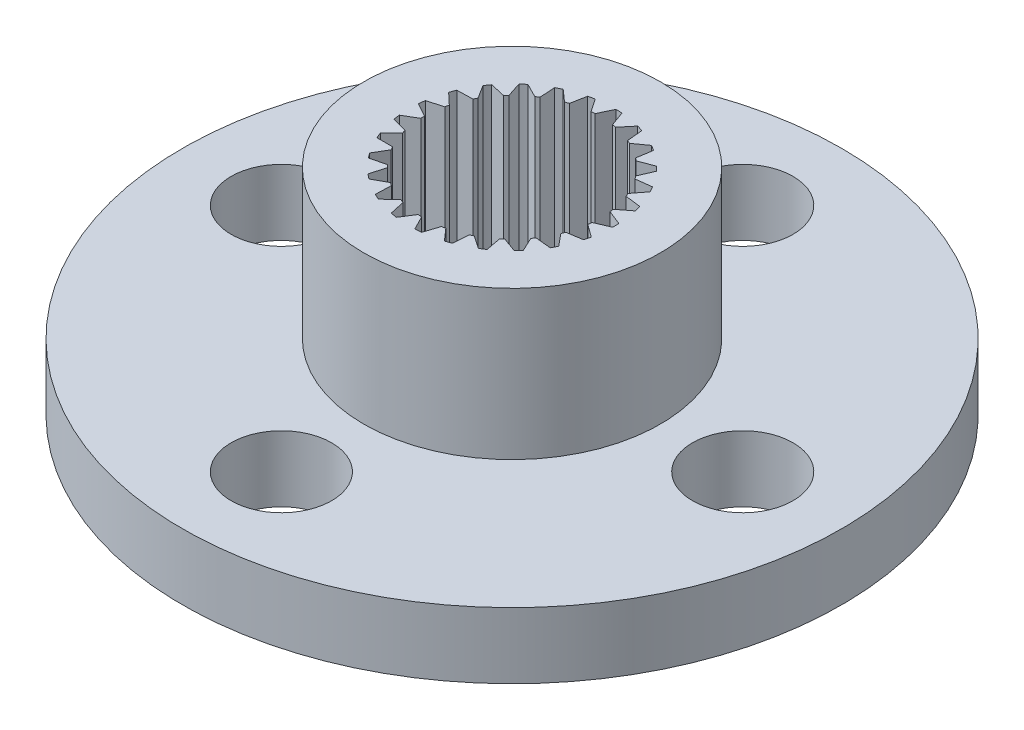
from build123d import *

# Parameters (mm, degrees)
SKETCH1_R           = 4.5
BOSS_EXTRUDE1_DEPTH = 6.5
SKETCH2_R           = 10
BOSS_EXTRUDE2_DEPTH = 2
SKETCH3_R           = 1.525
CUT_EXTRUDE1_DEPTH  = 78.553059866


with BuildPart() as part:
    # Sketch1 → Boss-Extrude1 (new body)
    with BuildSketch(Plane(origin=(24.301487189, 0, -59.250523978), x_dir=(0.9556278488633182, 0, 0.2945766699466665), z_dir=(0, -1, 0))):
        Circle(SKETCH1_R)
        with BuildLine():
            Line((-1.743463309, 2.563266606), (-1.337804671, 2.314678673))
            ThreePointArc((-1.337804671, 2.314678673), (-1.287955514, 2.342782383), (-1.237516253, 2.369812698))
            Line((-1.237516253, 2.369812698), (-1.230043219, 2.845521688))
            ThreePointArc((-1.230043219, 2.845521688), (-1.141186113, 2.882307106), (-1.05123072, 2.916318565))
            Line((-1.05123072, 2.916318565), (-0.7201379, 2.574657279))
            ThreePointArc((-0.7201379, 2.574657279), (-0.664865737, 2.589481077), (-0.609288952, 2.603118451))
            Line((-0.609288952, 2.603118451), (-0.483746682, 3.062023701))
            ThreePointArc((-0.483746682, 3.062023701), (-0.388533024, 3.075555574), (-0.292945439, 3.086127504))
            Line((-0.292945439, 3.086127504), (-0.057222215, 2.672860699))
            ThreePointArc((-0.057222215, 2.672860699), (0, 2.673473153), (0.057222215, 2.672860699))
            Line((0.057222215, 2.672860699), (0.292945439, 3.086127504))
            ThreePointArc((0.292945439, 3.086127504), (0.388533024, 3.075555574), (0.483746682, 3.062023701))
            Line((0.483746682, 3.062023701), (0.609288952, 2.603118451))
            ThreePointArc((0.609288952, 2.603118451), (0.664865737, 2.589481077), (0.7201379, 2.574657279))
            Line((0.7201379, 2.574657279), (1.05123072, 2.916318565))
            ThreePointArc((1.05123072, 2.916318565), (1.141186113, 2.882307106), (1.230043219, 2.845521688))
            Line((1.230043219, 2.845521688), (1.237516253, 2.369812698))
            ThreePointArc((1.237516253, 2.369812698), (1.287955514, 2.342782383), (1.337804671, 2.314678673))
            Line((1.337804671, 2.314678673), (1.743463309, 2.563266606))
            ThreePointArc((1.743463309, 2.563266606), (1.822134282, 2.507952683), (1.899051617, 2.450225083))
            Line((1.899051617, 2.450225083), (1.787985857, 1.987602897))
            ThreePointArc((1.787985857, 1.987602897), (1.830118309, 1.948878055), (1.871412256, 1.909260293))
            Line((1.871412256, 1.909260293), (2.326147686, 2.049155178))
            ThreePointArc((2.326147686, 2.049155178), (2.388591053, 1.976014368), (2.448735618, 1.900971824))
            Line((2.448735618, 1.900971824), (2.226109733, 1.480504696))
            ThreePointArc((2.226109733, 1.480504696), (2.257288041, 1.432518551), (2.287432125, 1.383876068))
            Line((2.287432125, 1.383876068), (2.762671649, 1.406287795))
            ThreePointArc((2.762671649, 1.406287795), (2.804963863, 1.319915804), (2.844556554, 1.232273514))
            Line((2.844556554, 1.232273514), (2.524358948, 0.88038094))
            ThreePointArc((2.524358948, 0.88038094), (2.542624063, 0.826148638), (2.559724222, 0.771537819))
            Line((2.559724222, 0.771537819), (3.025606792, 0.675058177))
            ThreePointArc((3.025606792, 0.675058177), (3.045090477, 0.580882075), (3.06164354, 0.486146927))
            Line((3.06164354, 0.486146927), (2.663993406, 0.224939612))
            ThreePointArc((2.663993406, 0.224939612), (2.668197664, 0.167868768), (2.671179432, 0.110721012))
            Line((2.671179432, 0.110721012), (3.098431932, -0.098587829))
            ThreePointArc((3.098431932, -0.098587829), (3.093882858, -0.194650611), (3.086356203, -0.290526059))
            Line((3.086356203, -0.290526059), (2.636239362, -0.444635499))
            ThreePointArc((2.636239362, -0.444635499), (2.626118593, -0.500958914), (2.614794614, -0.557052804))
            Line((2.614794614, -0.557052804), (2.9765712, -0.866039198))
            ThreePointArc((2.9765712, -0.866039198), (2.948275201, -0.957952683), (2.917141754, -1.048944224))
            Line((2.917141754, -1.048944224), (2.442840702, -1.086272527))
            ThreePointArc((2.442840702, -1.086272527), (2.419030833, -1.138309505), (2.394112634, -1.189824943))
            Line((2.394112634, -1.189824943), (2.667681551, -1.57907414))
            ThreePointArc((2.667681551, -1.57907414), (2.617416569, -1.661063064), (2.564632561, -1.741453366))
            Line((2.564632561, -1.741453366), (2.095949377, -1.659655056))
            ThreePointArc((2.095949377, -1.659655056), (2.059946468, -1.704135923), (2.022999752, -1.747836005))
            Line((2.022999752, -1.747836005), (2.19117166, -2.192890046))
            ThreePointArc((2.19117166, -2.192890046), (2.122096028, -2.259802745), (2.050978072, -2.324540589))
            Line((2.050978072, -2.324540589), (1.617361845, -2.128755355))
            ThreePointArc((1.617361845, -2.128755355), (1.571428092, -2.162885215), (1.524774356, -2.196024103))
            Line((1.524774356, -2.196024103), (1.576982395, -2.668918606))
            ThreePointArc((1.576982395, -2.668918606), (1.49343639, -2.716550708), (1.408453087, -2.761568377))
            Line((1.408453087, -2.761568377), (1.037149519, -2.464098126))
            ThreePointArc((1.037149519, -2.464098126), (0.984171108, -2.485732473), (0.930741779, -2.50622793))
            Line((0.930741779, -2.50622793), (0.863705526, -2.977249194))
            ThreePointArc((0.863705526, -2.977249194), (0.77093865, -3.002607799), (0.677429816, -3.025076668))
            Line((0.677429816, -3.025076668), (0.391769275, -2.644612549))
            ThreePointArc((0.391769275, -2.644612549), (0.335075035, -2.652392018), (0.278227274, -2.658956239))
            Line((0.278227274, -2.658956239), (0.096158863, -3.098508266))
            ThreePointArc((0.096158863, -3.098508266), (0, -3.1), (-0.096158863, -3.098508266))
            Line((-0.096158863, -3.098508266), (-0.278227274, -2.658956239))
            ThreePointArc((-0.278227274, -2.658956239), (-0.335075035, -2.652392018), (-0.391769275, -2.644612549))
            Line((-0.391769275, -2.644612549), (-0.677429816, -3.025076668))
            ThreePointArc((-0.677429816, -3.025076668), (-0.77093865, -3.002607799), (-0.863705526, -2.977249194))
            Line((-0.863705526, -2.977249194), (-0.930741779, -2.50622793))
            ThreePointArc((-0.930741779, -2.50622793), (-0.984171108, -2.485732473), (-1.037149519, -2.464098126))
            Line((-1.037149519, -2.464098126), (-1.408453087, -2.761568377))
            ThreePointArc((-1.408453087, -2.761568377), (-1.49343639, -2.716550708), (-1.576982395, -2.668918606))
            Line((-1.576982395, -2.668918606), (-1.524774356, -2.196024103))
            ThreePointArc((-1.524774356, -2.196024103), (-1.571428092, -2.162885215), (-1.617361845, -2.128755355))
            Line((-1.617361845, -2.128755355), (-2.050978072, -2.324540589))
            ThreePointArc((-2.050978072, -2.324540589), (-2.122096028, -2.259802745), (-2.19117166, -2.192890046))
            Line((-2.19117166, -2.192890046), (-2.022999752, -1.747836005))
            ThreePointArc((-2.022999752, -1.747836005), (-2.059946468, -1.704135923), (-2.095949377, -1.659655056))
            Line((-2.095949377, -1.659655056), (-2.564632561, -1.741453366))
            ThreePointArc((-2.564632561, -1.741453366), (-2.617416569, -1.661063064), (-2.667681551, -1.57907414))
            Line((-2.667681551, -1.57907414), (-2.394112634, -1.189824943))
            ThreePointArc((-2.394112634, -1.189824943), (-2.419030833, -1.138309505), (-2.442840702, -1.086272527))
            Line((-2.442840702, -1.086272527), (-2.917141754, -1.048944224))
            ThreePointArc((-2.917141754, -1.048944224), (-2.948275201, -0.957952683), (-2.9765712, -0.866039198))
            Line((-2.9765712, -0.866039198), (-2.614794614, -0.557052804))
            ThreePointArc((-2.614794614, -0.557052804), (-2.626118593, -0.500958914), (-2.636239362, -0.444635499))
            Line((-2.636239362, -0.444635499), (-3.086356203, -0.290526059))
            ThreePointArc((-3.086356203, -0.290526059), (-3.093882858, -0.194650611), (-3.098431932, -0.098587829))
            Line((-3.098431932, -0.098587829), (-2.671179432, 0.110721012))
            ThreePointArc((-2.671179432, 0.110721012), (-2.668197664, 0.167868768), (-2.663993406, 0.224939612))
            Line((-2.663993406, 0.224939612), (-3.06164354, 0.486146927))
            ThreePointArc((-3.06164354, 0.486146927), (-3.045090477, 0.580882075), (-3.025606792, 0.675058177))
            Line((-3.025606792, 0.675058177), (-2.559724222, 0.771537819))
            ThreePointArc((-2.559724222, 0.771537819), (-2.542624063, 0.826148638), (-2.524358948, 0.88038094))
            Line((-2.524358948, 0.88038094), (-2.844556554, 1.232273514))
            ThreePointArc((-2.844556554, 1.232273514), (-2.804963863, 1.319915804), (-2.762671649, 1.406287795))
            Line((-2.762671649, 1.406287795), (-2.287432125, 1.383876068))
            ThreePointArc((-2.287432125, 1.383876068), (-2.257288041, 1.432518551), (-2.226109733, 1.480504696))
            Line((-2.226109733, 1.480504696), (-2.448735618, 1.900971824))
            ThreePointArc((-2.448735618, 1.900971824), (-2.388591053, 1.976014368), (-2.326147686, 2.049155178))
            Line((-2.326147686, 2.049155178), (-1.871412256, 1.909260293))
            ThreePointArc((-1.871412256, 1.909260293), (-1.830118309, 1.948878055), (-1.787985857, 1.987602897))
            Line((-1.787985857, 1.987602897), (-1.899051617, 2.450225083))
            ThreePointArc((-1.899051617, 2.450225083), (-1.822134282, 2.507952683), (-1.743463309, 2.563266606))
        make_face(mode=Mode.SUBTRACT)
    extrude(amount=-BOSS_EXTRUDE1_DEPTH)

    # Sketch2 → Boss-Extrude2 (add)
    with BuildSketch(Plane(origin=(0, 0, 0), x_dir=(-1, 0, 0), z_dir=(0, -1, 0))):
        with Locations((-24.301487189, 59.250523978)):
            Circle(SKETCH2_R)
    extrude(amount=-BOSS_EXTRUDE2_DEPTH)

    # Sketch3 → Cut-Extrude1 (cut, through all)
    with BuildSketch(Plane(origin=(0, 0, 0), x_dir=(-1, 0, 0), z_dir=(0, -1, 0))):
        with Locations((-24.301487189, 66.250523978)):
            Circle(SKETCH3_R)
        with Locations((-17.301487189, 59.250523978)):
            Circle(SKETCH3_R)
        with Locations((-24.301487189, 52.250523978)):
            Circle(SKETCH3_R)
        with Locations((-31.301487189, 59.250523978)):
            Circle(SKETCH3_R)
    extrude(amount=-CUT_EXTRUDE1_DEPTH, mode=Mode.SUBTRACT)


solid = part.part
